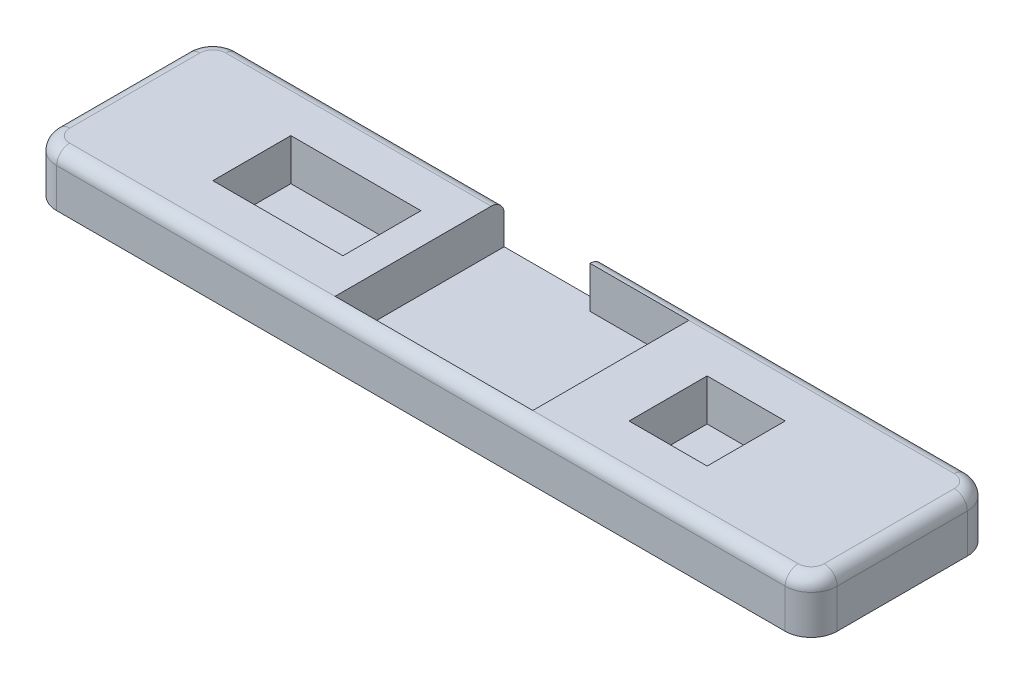
from build123d import *

# Parameters (mm, degrees)
SKETCH1_W           = 150
SKETCH1_H           = 35
SKETCH1_W_2         = 38
SKETCH1_H_2         = 30
SKETCH1_W_3         = 25
SKETCH1_H_3         = 15
SKETCH1_W_4         = 15
BOSS_EXTRUDE1_DEPTH = 10
SKETCH2_W           = 25
SKETCH2_H           = 15
SKETCH2_W_2         = 38
SKETCH2_H_2         = 30
SKETCH2_W_3         = 15
BOSS_EXTRUDE2_DEPTH = 2
SKETCH3_W           = 19
SKETCH3_H           = 2.5
CUT_EXTRUDE3_DEPTH  = 8
FILLET1_START       = -75
FILLET1_DEPTH       = 150
FILLET1_START_2     = -18
FILLET1_2_DEPTH     = 36
FILLET2_R           = 5


with BuildPart() as part:
    # Sketch1 → Boss-Extrude1 (new body)
    with BuildSketch(Plane(origin=(0, 0, 0), x_dir=(1, 0, 0), z_dir=(0, 1, 0))):
        Rectangle(SKETCH1_W, SKETCH1_H)
        Rectangle(SKETCH1_W_2, SKETCH1_H_2, mode=Mode.SUBTRACT)
        with Locations((-37.5, 0)):
            Rectangle(SKETCH1_W_3, SKETCH1_H_3, mode=Mode.SUBTRACT)
        with Locations((37.5, 0)):
            Rectangle(SKETCH1_W_4, SKETCH1_H_3, mode=Mode.SUBTRACT)
    extrude(amount=BOSS_EXTRUDE1_DEPTH)

    # Sketch2 → Boss-Extrude2 (add)
    with BuildSketch(Plane.XZ):
        with Locations((-37.5, 0)):
            Rectangle(SKETCH2_W, SKETCH2_H)
        Rectangle(SKETCH2_W_2, SKETCH2_H_2)
        with Locations((37.5, 0)):
            Rectangle(SKETCH2_W_3, SKETCH2_H)
    extrude(amount=-BOSS_EXTRUDE2_DEPTH)

    # Sketch3 → Cut-Extrude3 (cut)
    with BuildSketch(Plane(origin=(0, 2, 0), x_dir=(1, 0, 0), z_dir=(0, 1, 0))):
        with Locations((-9.5, 16.25)):
            Rectangle(SKETCH3_W, SKETCH3_H)
    extrude(amount=CUT_EXTRUDE3_DEPTH, mode=Mode.SUBTRACT)

    # Fillet1: read off the stored shape, not the designer's step
    # Fillet1 outline → Fillet1 (cut)
    with BuildSketch(Plane.YZ.offset(FILLET1_START)):
        with BuildLine():
            Line((10, -17.5), (10, -15))
            ThreePointArc((10, -15), (9.267766953, -16.767766953), (7.5, -17.5))
            Line((7.5, -17.5), (10, -17.5))
        make_face()
        with BuildLine():
            ThreePointArc((7.5, 17.5), (9.267766953, 16.767766953), (10, 15))
            Line((10, 15), (10, 17.5))
            Line((10, 17.5), (7.5, 17.5))
        make_face()
    extrude(amount=FILLET1_DEPTH, mode=Mode.SUBTRACT)

    # Fillet1 2 outline → Fillet1 2 (cut)
    with BuildSketch(Plane.XY.offset(FILLET1_START_2)):
        with BuildLine():
            Line((75, 10), (72.5, 10))
            ThreePointArc((72.5, 10), (74.267766953, 9.267766953), (75, 7.5))
            Line((75, 7.5), (75, 10))
        make_face()
        with BuildLine():
            ThreePointArc((-75, 7.5), (-74.267766953, 9.267766953), (-72.5, 10))
            Line((-72.5, 10), (-75, 10))
            Line((-75, 10), (-75, 7.5))
        make_face()
    extrude(amount=FILLET1_2_DEPTH, mode=Mode.SUBTRACT)

    # Fillet2
    # the kernel refuses this fillet: 5 mm, written as the material it takes off along each edge
    with BuildSketch(Plane(origin=(70, 10, -12.5), x_dir=(1, 0, 0), z_dir=(0, 0, 1))) as fillet2_piece_1:
        with BuildLine():
            CenterArc((2.5, -2.5), 2.5, 0, 90)
            Line((5, -2.5), (5, 0))
            Line((5, 0), (2.5, 0))
        make_face()
    revolve(axis=Axis((70, 10, -12.5), (0, 1, 0)), revolution_arc=90, mode=Mode.SUBTRACT)
    with BuildSketch(Plane(origin=(70, 10, 12.5), x_dir=(0, 0, 1), z_dir=(-1, 0, 0))) as fillet2_piece_2:
        with BuildLine():
            CenterArc((2.5, -2.5), 2.5, 0, 90)
            Line((5, -2.5), (5, 0))
            Line((5, 0), (2.5, 0))
        make_face()
    revolve(axis=Axis((70, 10, 12.5), (0, 1, 0)), revolution_arc=90, mode=Mode.SUBTRACT)
    with BuildSketch(Plane(origin=(-70, 10, -12.5), x_dir=(0, 0, -1), z_dir=(1, 0, 0))) as fillet2_piece_3:
        with BuildLine():
            CenterArc((2.5, -2.5), 2.5, 0, 90)
            Line((5, -2.5), (5, 0))
            Line((5, 0), (2.5, 0))
        make_face()
    revolve(axis=Axis((-70, 10, -12.5), (0, 1, 0)), revolution_arc=90, mode=Mode.SUBTRACT)
    with BuildSketch(Plane(origin=(-70, 10, 12.5), x_dir=(-1, 0, 0), z_dir=(0, 0, -1))) as fillet2_piece_4:
        with BuildLine():
            CenterArc((2.5, -2.5), 2.5, 0, 90)
            Line((5, -2.5), (5, 0))
            Line((5, 0), (2.5, 0))
        make_face()
    revolve(axis=Axis((-70, 10, 12.5), (0, 1, 0)), revolution_arc=90, mode=Mode.SUBTRACT)
    with BuildSketch(Plane(origin=(-75, -12.5, 17.5), x_dir=(1, 0, 0), z_dir=(0, 1, 0)), Plane(origin=(-75, -12.5, -17.5), x_dir=(0, 0, 1), z_dir=(0, 1, 0))) as fillet2_piece_5:
        with BuildLine():
            CenterArc((FILLET2_R, FILLET2_R), FILLET2_R, 180, 90)
            Line((0, FILLET2_R), (0, 0))
            Line((0, 0), (FILLET2_R, 0))
        make_face()
    extrude(amount=22.5, mode=Mode.SUBTRACT)
    with BuildSketch(Plane(origin=(75, -12.5, -17.5), x_dir=(0, 0, 1), z_dir=(0, 1, 0)), Plane(origin=(75, -12.5, 17.5), x_dir=(-1, 0, 0), z_dir=(0, 1, 0))) as fillet2_piece_6:
        with BuildLine():
            CenterArc((FILLET2_R, -FILLET2_R), FILLET2_R, 90, 90)
            Line((0, -FILLET2_R), (0, 0))
            Line((0, 0), (FILLET2_R, 0))
        make_face()
    extrude(amount=22.5, mode=Mode.SUBTRACT)


solid = part.part
